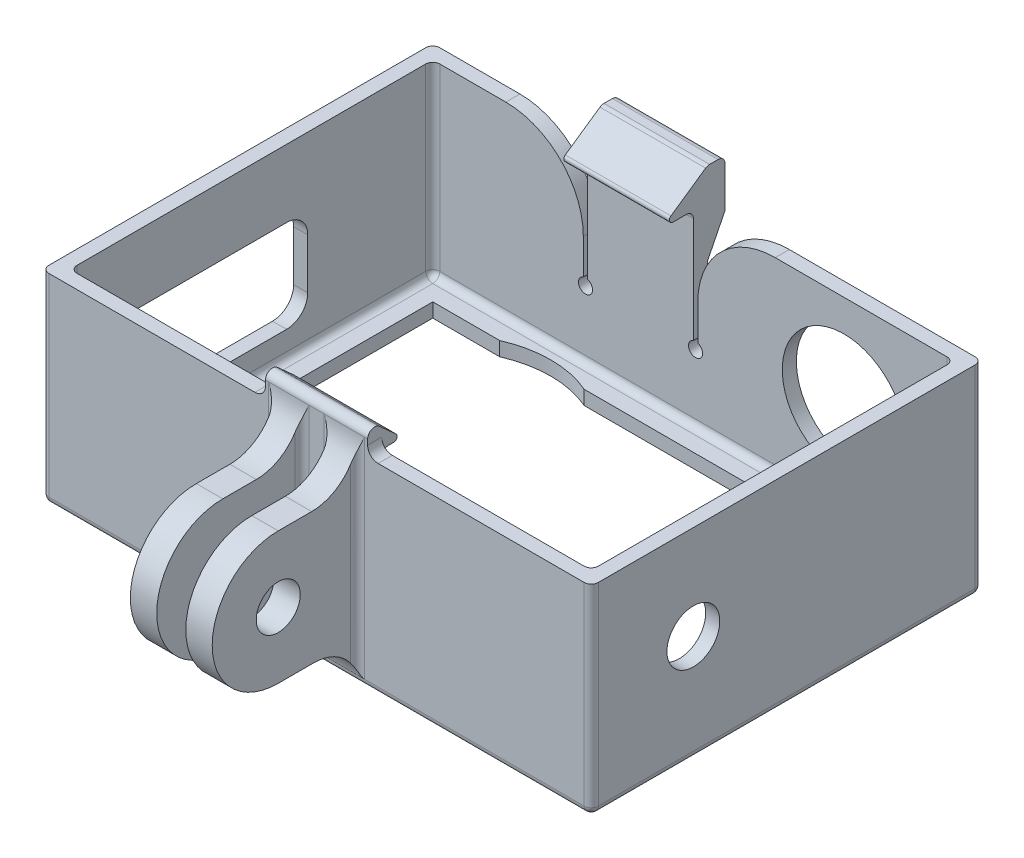
from build123d import *
from OCP.BRepAlgoAPI import BRepAlgoAPI_Cut
from OCP.TopTools import TopTools_ListOfShape

# Parameters (mm, degrees)
SKETCH1_W                = 59.2
SKETCH1_H                = 41.2
BOSS_EXTRUDE1_DEPTH      = 21.2
SHELL1_T                 = 1.6
SKETCH3_W                = 54
SKETCH3_H                = 36
CUT_EXTRUDE1_DEPTH       = 44.768938758
CUT_EXTRUDE2_REACH       = 60.26
BOSS_EXTRUDE2_DEPTH      = 12
BOSS_EXTRUDE3_DEPTH      = 5.8
BOSS_EXTRUDE3_DEPTH_BACK = 5.8
SKETCH9_R                = 7.5
SKETCH9_R_2              = 2.5
BOSS_EXTRUDE4_DEPTH      = 3
FILLET1_R                = 0.8
FILLET2_START            = -4.65
FILLET2_DEPTH            = 3
FILLET2_START_2          = 1.65
FILLET2_2_DEPTH          = 3
FILLET2_START_3          = -0.800001729
FILLET2_3_DEPTH          = 23.803711805
FILLET2_START_4          = -6
FILLET2_4_DEPTH          = 12
FILLET3_R                = 8.8
FILLET4_R                = 1.2
SKETCH12_R               = 7
CUT_EXTRUDE3_DEPTH       = 72.449072772
CUT_EXTRUDE4_DEPTH       = 2.8
CUT_EXTRUDE4_DEPTH_BACK  = 3.2
CUT_EXTRUDE5_DEPTH       = 3.2
SKETCH17_W               = 23
SKETCH17_H               = 10.5
CUT_EXTRUDE7_DEPTH       = 77.219223297
FILLET5_R                = 2.4
FILLET6_R                = 0.8
SKETCH19_R               = 3
CUT_EXTRUDE8_DEPTH       = 77.219223297
FILLET7_R                = 0.4
FILLET8_R                = 0.4


with BuildPart() as part:
    # Sketch1 → Boss-Extrude1 (new body)
    with BuildSketch(Plane(origin=(0, 0, 0), x_dir=(1, 0, 0), z_dir=(0, 1, 0))):
        Rectangle(SKETCH1_W, SKETCH1_H)
    extrude(amount=BOSS_EXTRUDE1_DEPTH)

    # Shell1
    shell1_openings = [part.faces().sort_by_distance(p)[0] for p in [
        (0, 21.2, 0),
    ]]
    offset(amount=SHELL1_T, openings=shell1_openings, kind=Kind.INTERSECTION)

    # Sketch3 → Cut-Extrude1 (cut, through all)
    with BuildSketch(Plane(origin=(0, 0, 0), x_dir=(1, 0, 0), z_dir=(0, 1, 0))):
        with BuildLine():
            Line((-19.395831523, 18), (-9.804168477, 18))
            ThreePointArc((-9.804168477, 18), (-14.6, 19), (-19.395831523, 18))
        make_face()
        Rectangle(SKETCH3_W, SKETCH3_H)
    extrude(amount=-CUT_EXTRUDE1_DEPTH, mode=Mode.SUBTRACT)

    # Sketch5 → Cut-Extrude2 (cut, up to next)
    with BuildSketch(Plane(origin=(0, 0, -22.2), x_dir=(-1, 0, 0), z_dir=(0, 0, -1)), mode=Mode.PRIVATE) as cut_extrude2_sk1:
        with BuildLine():
            Line((12.5, 21.2), (12, 21.2))
            Line((12, 21.2), (12, 8.4))
            ThreePointArc((12, 8.4), (12.25, 8.440065792), (12.5, 8.4))
            Line((12.5, 8.4), (12.5, 21.2))
        make_face()
    cut_extrude2_tool1 = extrude(cut_extrude2_sk1.sketch, amount=-CUT_EXTRUDE2_REACH, mode=Mode.PRIVATE) & part.part
    # Sketch5 → Cut-Extrude2 (cut, up to next)
    with BuildSketch(Plane(origin=(0, 0, -22.2), x_dir=(-1, 0, 0), z_dir=(0, 0, -1)), mode=Mode.PRIVATE) as cut_extrude2_sk2:
        with BuildLine():
            Line((0, 8.4), (0, 21.2))
            Line((0, 21.2), (-0.5, 21.2))
            Line((-0.5, 21.2), (-0.5, 8.4))
            ThreePointArc((-0.5, 8.4), (-0.25, 8.440065792), (0, 8.4))
        make_face()
    cut_extrude2_tool2 = extrude(cut_extrude2_sk2.sketch, amount=-CUT_EXTRUDE2_REACH, mode=Mode.PRIVATE) & part.part
    # Sketch5 → Cut-Extrude2 (cut, up to next)
    with BuildSketch(Plane(origin=(0, 0, -22.2), x_dir=(-1, 0, 0), z_dir=(0, 0, -1)), mode=Mode.PRIVATE) as cut_extrude2_sk3:
        with BuildLine():
            ThreePointArc((0.55, 7.640065792), (0.39807407, 8.109107368), (0, 8.4))
            Line((0, 8.4), (-0.5, 8.4))
            ThreePointArc((-0.5, 8.4), (-0.719041576, 6.991991722), (0.55, 7.640065792))
        make_face()
    cut_extrude2_tool3 = extrude(cut_extrude2_sk3.sketch, amount=-CUT_EXTRUDE2_REACH, mode=Mode.PRIVATE) & part.part
    # Sketch5 → Cut-Extrude2 (cut, up to next)
    with BuildSketch(Plane(origin=(0, 0, -22.2), x_dir=(-1, 0, 0), z_dir=(0, 0, -1)), mode=Mode.PRIVATE) as cut_extrude2_sk4:
        with BuildLine():
            Line((-0.5, 8.4), (0, 8.4))
            ThreePointArc((0, 8.4), (-0.25, 8.440065792), (-0.5, 8.4))
        make_face()
    cut_extrude2_tool4 = extrude(cut_extrude2_sk4.sketch, amount=-CUT_EXTRUDE2_REACH, mode=Mode.PRIVATE) & part.part
    # Sketch5 → Cut-Extrude2 (cut, up to next)
    with BuildSketch(Plane(origin=(0, 0, -22.2), x_dir=(-1, 0, 0), z_dir=(0, 0, -1)), mode=Mode.PRIVATE) as cut_extrude2_sk5:
        with BuildLine():
            ThreePointArc((12.5, 8.4), (12.25, 8.440065792), (12, 8.4))
            Line((12, 8.4), (12.5, 8.4))
        make_face()
    cut_extrude2_tool5 = extrude(cut_extrude2_sk5.sketch, amount=-CUT_EXTRUDE2_REACH, mode=Mode.PRIVATE) & part.part
    # Sketch5 → Cut-Extrude2 (cut, up to next)
    with BuildSketch(Plane(origin=(0, 0, -22.2), x_dir=(-1, 0, 0), z_dir=(0, 0, -1)), mode=Mode.PRIVATE) as cut_extrude2_sk6:
        with BuildLine():
            Line((12.5, 8.4), (12, 8.4))
            ThreePointArc((12, 8.4), (11.780958424, 6.991991722), (13.05, 7.640065792))
            ThreePointArc((13.05, 7.640065792), (12.89807407, 8.109107368), (12.5, 8.4))
        make_face()
    cut_extrude2_tool6 = extrude(cut_extrude2_sk6.sketch, amount=-CUT_EXTRUDE2_REACH, mode=Mode.PRIVATE) & part.part
    add(cut_extrude2_tool1.solids().sort_by_distance((-12.25, 14.813418, -22.2))[0], mode=Mode.SUBTRACT)
    add(cut_extrude2_tool2.solids().sort_by_distance((0.25, 14.813418, -22.2))[0], mode=Mode.SUBTRACT)
    add(cut_extrude2_tool3.solids().sort_by_distance((0.25, 7.63485, -22.2))[0], mode=Mode.SUBTRACT)
    add(cut_extrude2_tool4.solids().sort_by_distance((0.25, 8.416061, -22.2))[0], mode=Mode.SUBTRACT)
    add(cut_extrude2_tool5.solids().sort_by_distance((-12.25, 8.416061, -22.2))[0], mode=Mode.SUBTRACT)
    add(cut_extrude2_tool6.solids().sort_by_distance((-12.25, 7.63485, -22.2))[0], mode=Mode.SUBTRACT)

    # Sketch6 → Boss-Extrude2 (add)
    with BuildSketch(Plane.ZY.offset(12)):
        Polygon((-22.2, 24.8), (-22.2, 21.2), (-20.6, 21.2), (-17, 21.2), align=None)
        Polygon((-22.2, 8.4), (-22.2, 21.2), (-22.2, 24.8), (-24.2, 24.8), (-24.2, 4.4), (-22.2, 4.4), align=None)
        Polygon((-24.2, 4.4), (-22.2, 0.4), (-22.2, 4.4), align=None)
    extrude(amount=-BOSS_EXTRUDE2_DEPTH)

    # Sketch7 → Boss-Extrude3 (add, two sides: drawn at the far end of the back side and taken through both)
    with BuildSketch(Plane(origin=(0, 0, 0), x_dir=(0, 0, -1), z_dir=(1, 0, 0)).offset(-BOSS_EXTRUDE3_DEPTH_BACK)):
        Polygon((-22.2, 21.2), (-18.2, 21.2), (-22.2, 24.8), align=None)
    extrude(amount=BOSS_EXTRUDE3_DEPTH + BOSS_EXTRUDE3_DEPTH_BACK)

    # Sketch9 → Boss-Extrude4 (add)
    # profile 1 of 2: a face of its own
    with BuildSketch(Plane(origin=(1.65, 0, 0), x_dir=(0, 0, -1), z_dir=(1, 0, 0))):
        with BuildLine():
            Line((-22.2, 17.9), (-31.2, 17.9))
            ThreePointArc((-31.2, 17.9), (-25.896699141, 15.703300859), (-23.7, 10.4))
            ThreePointArc((-23.7, 10.4), (-25.896699141, 5.096699141), (-31.2, 2.9))
            Line((-31.2, 2.9), (-22.2, 2.9))
            Line((-22.2, 2.9), (-22.2, 17.9))
        make_face()
    # profile 2 of 2: a face of its own
    with BuildSketch(Plane(origin=(1.65, 0, 0), x_dir=(0, 0, -1), z_dir=(1, 0, 0))):
        with Locations((-31.2, 10.4)):
            Circle(SKETCH9_R)
        with Locations((-31.2, 10.4)):
            Circle(SKETCH9_R_2, mode=Mode.SUBTRACT)
    boss_extrude4 = extrude(amount=BOSS_EXTRUDE4_DEPTH)

    # Mirror2: Boss-Extrude4 across plane
    add(boss_extrude4.mirror(Plane(origin=(0, 0, 0), x_dir=(0, 0, 1), z_dir=(1, 0, 0))))

    # Fillet1
    fillet1_edges = [part.edges().sort_by_distance(p)[0] for p in [
        (0, 24.8, 22.2),
        (0, 21.2, 20.6),
        (-6, 21.2, -20.6),
        (4.65, 10.4, 22.2),
        (1.65, 10.4, 22.2),
        (-4.65, 10.4, 22.2),
        (-1.65, 10.4, 22.2),
        (31.2, 9.8, -22.2),
        (0, -1.6, -22.2),
        (-31.2, 9.8, -22.2),
        (-31.2, -1.6, 0),
        (31.2, -1.6, 0),
        (31.2, 9.8, 22.2),
        (0, -1.6, 22.2),
        (29.6, 0, 0),
        (0, 0, -20.6),
        (0, 0, 20.6),
        (-29.6, 0, 0),
        (-31.2, 9.8, 22.2),
        (-29.6, 10.6, -20.6),
        (29.6, 10.6, 20.6),
        (29.6, 10.6, -20.6),
        (-29.6, 10.6, 20.6),
    ]]
    fillet(fillet1_edges, radius=FILLET1_R)


with BuildPart() as fillet2_tool:
    # Fillet2: read off the stored shape, not the designer's step
    # Fillet2 outline → Fillet2 (new body)
    with BuildSketch(Plane.YZ.offset(FILLET2_START)):
        with BuildLine():
            Line((-0.800039625, 22.199988063), (2.9, 22.2))
            Line((2.9, 22.2), (2.9, 27.178955714))
            ThreePointArc((2.9, 27.178955714), (1.873715009, 24.077326622), (-0.800039625, 22.199988063))
        make_face()
        with BuildLine():
            ThreePointArc((23.003710076, 22.2), (19.389157265, 23.756355851), (17.9, 27.399108409))
            Line((17.9, 27.399108409), (17.9, 22.2))
            Line((17.9, 22.2), (23.003710076, 22.2))
        make_face()
    extrude(amount=FILLET2_DEPTH)


with BuildPart() as part_1:
    add(part.part)


with BuildPart() as part_2:
    # Fillet2: joined with fillet2_tool
    add(part_1.part.fuse(fillet2_tool.part, tol=0.00001))


with BuildPart() as fillet2_2_tool:
    # Fillet2 2 outline → Fillet2 2 (new body)
    with BuildSketch(Plane.YZ.offset(FILLET2_START_2)):
        with BuildLine():
            Line((-0.800039625, 22.199988063), (2.9, 22.2))
            Line((2.9, 22.2), (2.9, 27.178955714))
            ThreePointArc((2.9, 27.178955714), (1.873715009, 24.077326622), (-0.800039625, 22.199988063))
        make_face()
        with BuildLine():
            ThreePointArc((23.003710076, 22.2), (19.389157265, 23.756355851), (17.9, 27.399108409))
            Line((17.9, 27.399108409), (17.9, 22.2))
            Line((17.9, 22.2), (23.003710076, 22.2))
        make_face()
    extrude(amount=FILLET2_2_DEPTH)


with BuildPart() as part_3:
    add(part_2.part)


with BuildPart() as part_4:
    # Fillet2 2: joined with fillet2_2_tool
    add(part_3.part.fuse(fillet2_2_tool.part, tol=0.00001))


with BuildPart() as fillet2_3_tool:
    # Fillet2 3 outline → Fillet2 3 (new body)
    with BuildSketch(Plane(origin=(0, 0, 0), x_dir=(1, 0, 0), z_dir=(0, 1, 0)).offset(FILLET2_START_3)):
        with BuildLine():
            ThreePointArc((-1.65, -23), (-1.415685425, -22.434314575), (-0.85, -22.2))
            Line((-0.85, -22.2), (-1.65, -22.2))
            Line((-1.65, -22.2), (-1.65, -23))
        make_face()
        with BuildLine():
            ThreePointArc((0.85, -22.2), (1.415685425, -22.434314575), (1.65, -23))
            Line((1.65, -23), (1.65, -22.2))
            Line((1.65, -22.2), (0.85, -22.2))
        make_face()
        with BuildLine():
            Line((-4.65, -22.2), (-5.45, -22.2))
            ThreePointArc((-5.45, -22.2), (-4.884314575, -22.434314575), (-4.65, -23))
            Line((-4.65, -23), (-4.65, -22.2))
        make_face()
        with BuildLine():
            Line((4.65, -22.2), (4.65, -23))
            ThreePointArc((4.65, -23), (4.884314575, -22.434314575), (5.45, -22.2))
            Line((5.45, -22.2), (4.65, -22.2))
        make_face()
    extrude(amount=FILLET2_3_DEPTH)


with BuildPart() as part_5:
    add(part_4.part)


with BuildPart() as part_6:
    # Fillet2 3: joined with fillet2_3_tool
    add(part_5.part.fuse(fillet2_3_tool.part, tol=0.00001))


with BuildPart() as fillet2_4_tool:
    # Fillet2 4 outline → Fillet2 4 (new body)
    with BuildSketch(Plane.YZ.offset(FILLET2_START_4)):
        with BuildLine():
            ThreePointArc((-0.8, 22.200000001), (0.031845969, 22.531107354), (0.794564451, 23))
            Line((0.794564451, 23), (-0.800001729, 23))
            Line((-0.800001729, 23), (-0.8, 22.200000001))
        make_face()
        with BuildLine():
            Line((23.003710076, 23), (20.327303621, 23))
            ThreePointArc((20.327303621, 23), (21.610781883, 22.416917184), (23.003710076, 22.2))
            Line((23.003710076, 22.2), (23.003710076, 23))
        make_face()
    extrude(amount=FILLET2_4_DEPTH)


with BuildPart() as part_7:
    add(part_6.part)

    # Fillet2 4: cut by fillet2_4_tool, with a tolerance
    fillet2_4_stock = TopTools_ListOfShape()
    fillet2_4_stock.Append(part_7.part.wrapped)
    fillet2_4_tools = TopTools_ListOfShape()
    fillet2_4_tools.Append(fillet2_4_tool.part.wrapped)
    fillet2_4_cut = BRepAlgoAPI_Cut()
    fillet2_4_cut.SetArguments(fillet2_4_stock)
    fillet2_4_cut.SetTools(fillet2_4_tools)
    fillet2_4_cut.SetFuzzyValue(0.00001)
    fillet2_4_cut.Build()
    add(Compound.cast(fillet2_4_cut.Shape()).solids(), mode=Mode.REPLACE)

    # Fillet3
    fillet3_edges = [part_7.edges().sort_by_distance(p)[0] for p in [
        (0.5, 21.2, -21.4),
        (-12.5, 21.2, -21.4),
    ]]
    fillet(fillet3_edges, radius=FILLET3_R)

    # Fillet4
    fillet4_edges = [part_7.edges().sort_by_distance(p)[0] for p in [
        (-5.8, 21.2, 21.4),
        (5.8, 21.2, 21.4),
    ]]
    fillet(fillet4_edges, radius=FILLET4_R)

    # Sketch12 → Cut-Extrude3 (cut, through all)
    with BuildSketch(Plane.XY.offset(-20.6)):
        with Locations((17.1, 10.6)):
            Circle(SKETCH12_R)
    extrude(amount=-CUT_EXTRUDE3_DEPTH, mode=Mode.SUBTRACT)

    # Sketch14 → Cut-Extrude4 (cut, two sides: drawn at the far end of the back side and taken through both)
    with BuildSketch(Plane(origin=(0, 0, 0), x_dir=(0, 0, -1), z_dir=(1, 0, 0)).offset(-CUT_EXTRUDE4_DEPTH_BACK)):
        Polygon((24.2, 4.4), (24.2, 19.4), (22.2, 15.4), (22.2, 6.880131585), (22.2, 0.4), align=None)
    extrude(amount=CUT_EXTRUDE4_DEPTH + CUT_EXTRUDE4_DEPTH_BACK, mode=Mode.SUBTRACT)

    # Sketch15 → Cut-Extrude5 (cut)
    with BuildSketch(Plane.ZY.offset(12)):
        Polygon((-22.2, 15.4), (-24.2, 19.4), (-24.2, 4.4), (-22.2, 0.4), (-22.2, 6.880131585), (-22.2, 8.4), align=None)
    extrude(amount=-CUT_EXTRUDE5_DEPTH, mode=Mode.SUBTRACT)

    # Sketch17 → Cut-Extrude7 (cut, through all)
    with BuildSketch(Plane(origin=(-29.6, 0, 0), x_dir=(0, 0, -1), z_dir=(1, 0, 0))):
        with Locations((-5.1, 8.25)):
            Rectangle(SKETCH17_W, SKETCH17_H)
    extrude(amount=-CUT_EXTRUDE7_DEPTH, mode=Mode.SUBTRACT)

    # Fillet5
    fillet5_edges = [part_7.edges().sort_by_distance(p)[0] for p in [
        (-30.4, 13.5, -6.4),
        (-30.4, 3, -6.4),
        (-30.4, 3, 16.6),
        (-30.4, 13.5, 16.6),
    ]]
    fillet(fillet5_edges, radius=FILLET5_R)

    # Fillet6
    fillet6_edges = [part_7.edges().sort_by_distance(p)[0] for p in [
        (-6, 24.8, -22.2),
        (-6, 24.8, -24.2),
    ]]
    fillet(fillet6_edges, radius=FILLET6_R)

    # Sketch19 → Cut-Extrude8 (cut, through all)
    with BuildSketch(Plane.ZY.offset(-29.6)):
        with Locations((10.6, 10.5)):
            Circle(SKETCH19_R)
    extrude(amount=-CUT_EXTRUDE8_DEPTH, mode=Mode.SUBTRACT)

    # Fillet7
    fillet7_edges = [part_7.edges().sort_by_distance(p)[0] for p in [
        (-6, 21.2, -17),
    ]]
    fillet(fillet7_edges, radius=FILLET7_R)

    # Fillet8
    fillet8_edges = [part_7.edges().sort_by_distance(p)[0] for p in [
        (0, 21.2, 18.2),
    ]]
    fillet(fillet8_edges, radius=FILLET8_R)


solid = part_7.part
